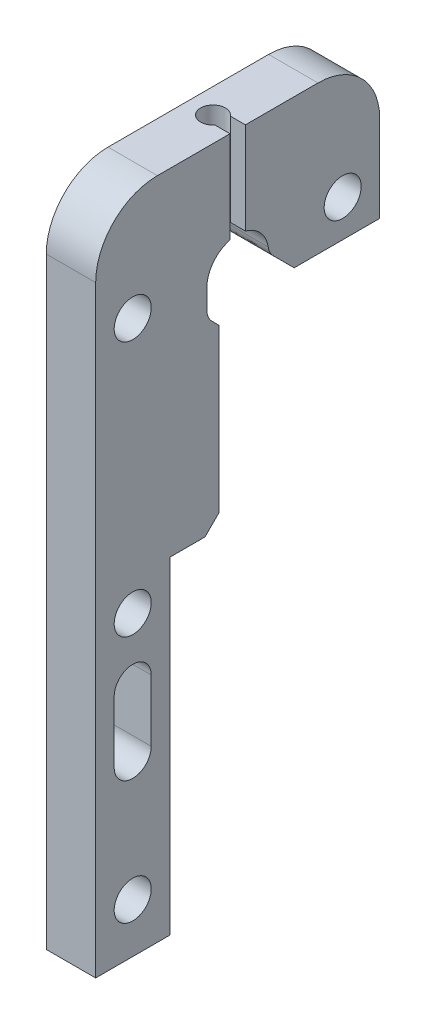
from build123d import *

# Parameters (mm, degrees)
SKETCH1_W                       = 46
SKETCH1_H                       = 95.52
BOSS_EXTRUDE1_DEPTH             = 8
F_6_0MM_CLEARANCE_DOWEL_HOLE1_D = 6
SKETCH4_W                       = 8
SKETCH4_H                       = 46
BOSS_EXTRUDE2_DEPTH             = 12
FILLET1_R                       = 10
SKETCH6_R                       = 2
CUT_EXTRUDE2_DEPTH              = 15
SKETCH9_W                       = 26
SKETCH9_H                       = 30.52
CUT_EXTRUDE5_DEPTH              = 65.531059189
F_6_0MM_CLEARANCE_DOWEL_HOLE2_D = 6
CUT_EXTRUDE13_DEPTH             = 65.531059189
SKETCH7_W                       = 2.5
SKETCH7_H                       = 15
CUT_EXTRUDE12_DEPTH             = 4
SKETCH16_W                      = 34
SKETCH16_H                      = 53
CUT_EXTRUDE9_DEPTH              = 65.531059294
CUT_EXTRUDE14_DEPTH             = 65.531059294
CUT_EXTRUDE15_DEPTH             = 65.531059294
FILLET2_START                   = -1
FILLET2_DEPTH                   = 10
SKETCH22_R                      = 3
CUT_EXTRUDE16_DEPTH             = 65.531059329


with BuildPart() as part:
    # Sketch1 → Boss-Extrude1 (new body)
    with BuildSketch(Plane(origin=(0, 0, 0), x_dir=(0, 0, -1), z_dir=(1, 0, 0))):
        Rectangle(SKETCH1_W, SKETCH1_H)
    extrude(amount=BOSS_EXTRUDE1_DEPTH)

    # Ø6.0mm Clearance Dowel Hole1 (through all)
    with Locations(Plane(origin=(8, 0, 0), x_dir=(0, 0, -1), z_dir=(1, 0, 0))):
        with Locations((-17, 41.76), (17, 41.76)):
            Hole(F_6_0MM_CLEARANCE_DOWEL_HOLE1_D / 2)

    # Sketch4 → Boss-Extrude2 (add)
    with BuildSketch(Plane(origin=(0, 47.76, 0), x_dir=(1, 0, 0), z_dir=(0, 1, 0))):
        with Locations((4, 0)):
            Rectangle(SKETCH4_W, SKETCH4_H)
    extrude(amount=BOSS_EXTRUDE2_DEPTH)

    # Fillet1
    fillet1_edges = [part.edges().sort_by_distance(p)[0] for p in [
        (4, 59.76, 23),
        (4, 59.76, -23),
    ]]
    fillet(fillet1_edges, radius=FILLET1_R)

    # Sketch6 → Cut-Extrude2 (cut)
    with BuildSketch(Plane(origin=(0, 59.76, 0), x_dir=(1, 0, 0), z_dir=(0, 1, 0))):
        with Locations(Location((4, 0, 0), (0, 0, 270))):
            Circle(SKETCH6_R)
    extrude(amount=-CUT_EXTRUDE2_DEPTH, mode=Mode.SUBTRACT)

    # Sketch9 → Cut-Extrude5 (cut, through all)
    with BuildSketch(Plane(origin=(8, 0, 0), x_dir=(0, 0, -1), z_dir=(1, 0, 0))):
        with Locations((10, 20.5)):
            Rectangle(SKETCH9_W, SKETCH9_H)
    extrude(amount=-CUT_EXTRUDE5_DEPTH, mode=Mode.SUBTRACT)

    # Ø6.0mm Clearance Dowel Hole2 (through all)
    with Locations(Plane(origin=(8, 0, 0), x_dir=(0, 0, -1), z_dir=(1, 0, 0))):
        with Locations((-17, -39.76)):
            Hole(F_6_0MM_CLEARANCE_DOWEL_HOLE2_D / 2)

    # Sketch14 → Cut-Extrude13 (cut, through all)
    with BuildSketch(Plane(origin=(8, 0, 0), x_dir=(0, 0, -1), z_dir=(1, 0, 0))):
        with BuildLine():
            Line((5, 40.013359235), (5, 35.76))
            Line((5, 35.76), (-5, 35.76))
            Line((-5, 35.76), (-5, 40.013359235))
            ThreePointArc((-5, 40.013359235), (0, 45.013359235), (5, 40.013359235))
        make_face()
    extrude(amount=-CUT_EXTRUDE13_DEPTH, mode=Mode.SUBTRACT)

    # Sketch7 → Cut-Extrude12 (cut)
    with BuildSketch(Plane(origin=(8, 0, 0), x_dir=(0, 0, -1), z_dir=(1, 0, 0))):
        with Locations((0, 52.26)):
            Rectangle(SKETCH7_W, SKETCH7_H)
    extrude(amount=-CUT_EXTRUDE12_DEPTH, mode=Mode.SUBTRACT)

    # Sketch16 → Cut-Extrude9 (cut, through all)
    with BuildSketch(Plane(origin=(8, 0, 0), x_dir=(0, 0, -1), z_dir=(1, 0, 0))):
        with Locations((6, -21.26)):
            Rectangle(SKETCH16_W, SKETCH16_H)
    extrude(amount=-CUT_EXTRUDE9_DEPTH, mode=Mode.SUBTRACT)

    # Sketch19 → Cut-Extrude14 (cut, through all)
    with BuildSketch(Plane(origin=(8, 0, 0), x_dir=(0, 0, -1), z_dir=(1, 0, 0))):
        Polygon((-5, 35.76), (3.485281374, 27.274718626), (10.556349186, 34.345786438), (2.071067812, 42.831067812), align=None)
    extrude(amount=-CUT_EXTRUDE14_DEPTH, mode=Mode.SUBTRACT)

    # Sketch21 → Cut-Extrude15 (cut, through all)
    with BuildSketch(Plane(origin=(8, 0, 0), x_dir=(0, 0, -1), z_dir=(1, 0, 0))):
        Polygon((-3, 7.538097039), (-5.298097039, 5.24), (-3, 5.24), align=None)
    extrude(amount=-CUT_EXTRUDE15_DEPTH, mode=Mode.SUBTRACT)

    # Fillet2: read off the stored shape, not the designer's step
    # Fillet2 outline → Fillet2 (cut)
    with BuildSketch(Plane.YZ.offset(FILLET2_START)):
        with BuildLine():
            add(Edge.make_bspline(
                [(40.779548187, -4.94094672), (39.810996275, -5.091139348), (39.117941215, -5.784194408)],
                knots=[0, 0, 0, 1, 1, 1], degree=2))
            ThreePointArc((40.779548187, -4.94094672), (40.397589895, -4.98521482), (40.013359235, -5))
            Line((40.013359235, -5), (39.902135624, -5))
            Line((39.902135624, -5), (39.117941215, -5.784194408))
        make_face()
    extrude(amount=FILLET2_DEPTH, mode=Mode.SUBTRACT)

    # Fillet3
    # a fillet whose section is not a circle: 3 mm, written as the material it adds along each edge
    with BuildSketch(Plane(origin=(8, 35.76, 5), x_dir=(0, 1, 0), z_dir=(-1, 0, 0))) as fillet3_piece_1:
        with BuildLine():
            Bezier((1.242640687, 0), (0, 0), (-0.878679656, 0.878679656), weights=[1, 1, 1])
            Line((-0.878679656, 0.878679656), (0, 0))
            Line((0, 0), (1.242640687, 0))
        make_face()
    extrude(amount=8)

    # Sketch22 → Cut-Extrude16 (cut, through all)
    with BuildSketch(Plane(origin=(8, 0, 0), x_dir=(0, 0, -1), z_dir=(1, 0, 0))):
        with Locations((-17, 0.39)):
            Circle(SKETCH22_R)
        with BuildLine():
            Line((-14, -9.77), (-14, -19.77))
            ThreePointArc((-14, -19.77), (-17, -22.77), (-20, -19.77))
            Line((-20, -19.77), (-20, -9.77))
            ThreePointArc((-20, -9.77), (-17, -6.77), (-14, -9.77))
        make_face()
    extrude(amount=-CUT_EXTRUDE16_DEPTH, mode=Mode.SUBTRACT)


solid = part.part
